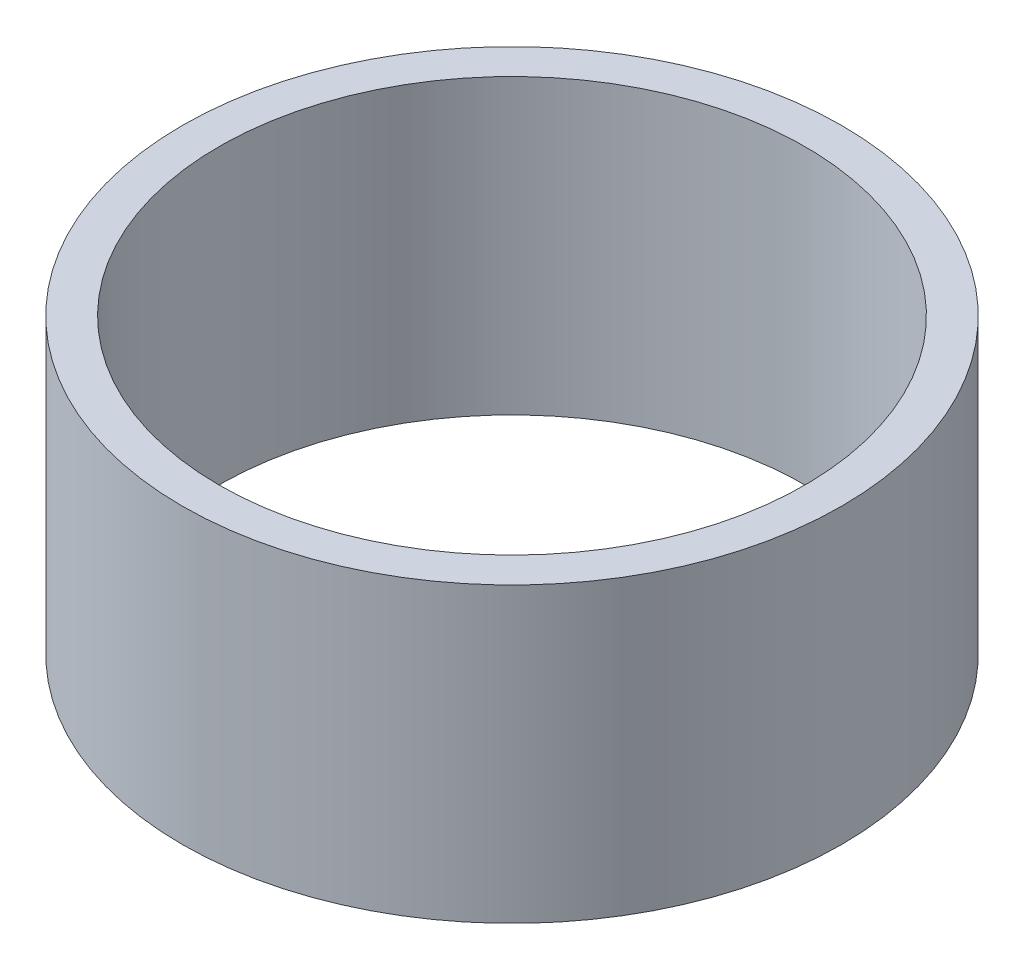
from build123d import *

# Parameters (mm, degrees)
SKETCH1_R           = 22.5
SKETCH1_R_2         = 20
BOSS_EXTRUDE1_DEPTH = 20


with BuildPart() as part:
    # Sketch1 → Boss-Extrude1 (new body)
    with BuildSketch(Plane(origin=(0, 0, 0), x_dir=(1, 0, 0), z_dir=(0, 1, 0))):
        Circle(SKETCH1_R)
        Circle(SKETCH1_R_2, mode=Mode.SUBTRACT)
    extrude(amount=BOSS_EXTRUDE1_DEPTH)


solid = part.part
